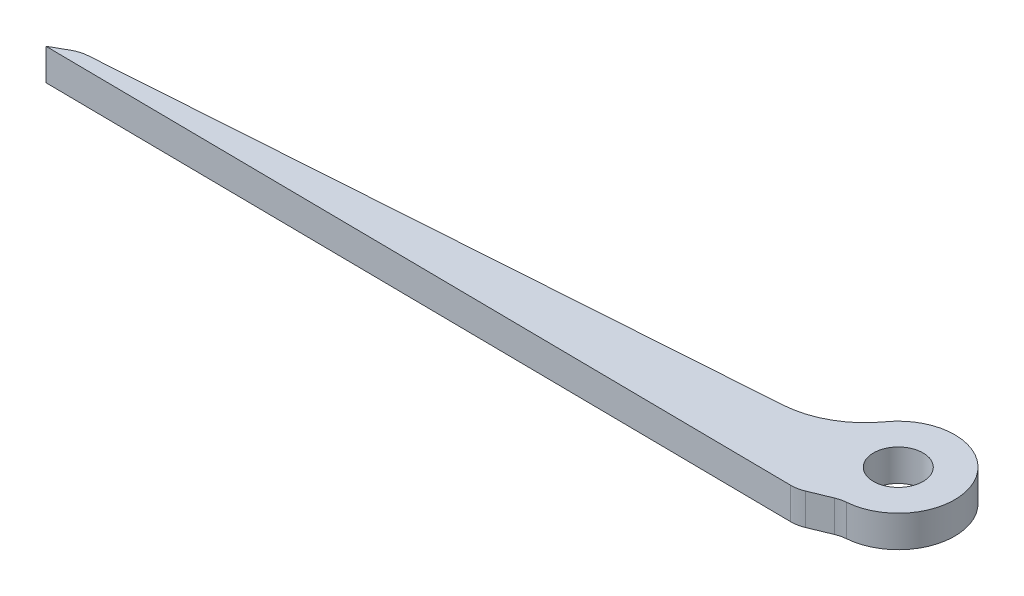
from build123d import *

# Parameters (mm, degrees)
SKETCH1_R           = 2.4892
BOSS_EXTRUDE1_DEPTH = 3.175
FILLET1_R           = 3.175
FILLET2_R           = 8.89


with BuildPart() as part:
    # Sketch1 → Boss-Extrude1 (new body)
    with BuildSketch(Plane(origin=(0, 0, 0), x_dir=(1, 0, 0), z_dir=(0, 1, 0))):
        with BuildLine():
            Line((-5.6642, 0), (-77.17919455, -4.935559597))
            Line((-77.17919455, -4.935559597), (-79.392042792, -6.182516957))
            Line((-79.392042792, -6.182516957), (-3.192042792, -6.978381463))
            Line((-3.192042792, -6.978381463), (0, -5.6642))
            ThreePointArc((0, -5.6642), (4.00519423, 4.00519423), (-5.6642, 0))
        make_face()
        Circle(SKETCH1_R, mode=Mode.SUBTRACT)
    extrude(amount=BOSS_EXTRUDE1_DEPTH)

    # Fillet1
    fillet1_edges = [part.edges().sort_by_distance(p)[0] for p in [
        (-77.17919455, 1.5875, 4.935559597),
        (-3.192042792, 1.5875, 6.978381463),
        (0, 1.5875, 5.6642),
    ]]
    fillet(fillet1_edges, radius=FILLET1_R)

    # Fillet2
    fillet2_edges = [part.edges().sort_by_distance(p)[0] for p in [
        (-5.6642, 1.5875, 0),
    ]]
    fillet(fillet2_edges, radius=FILLET2_R)


solid = part.part
